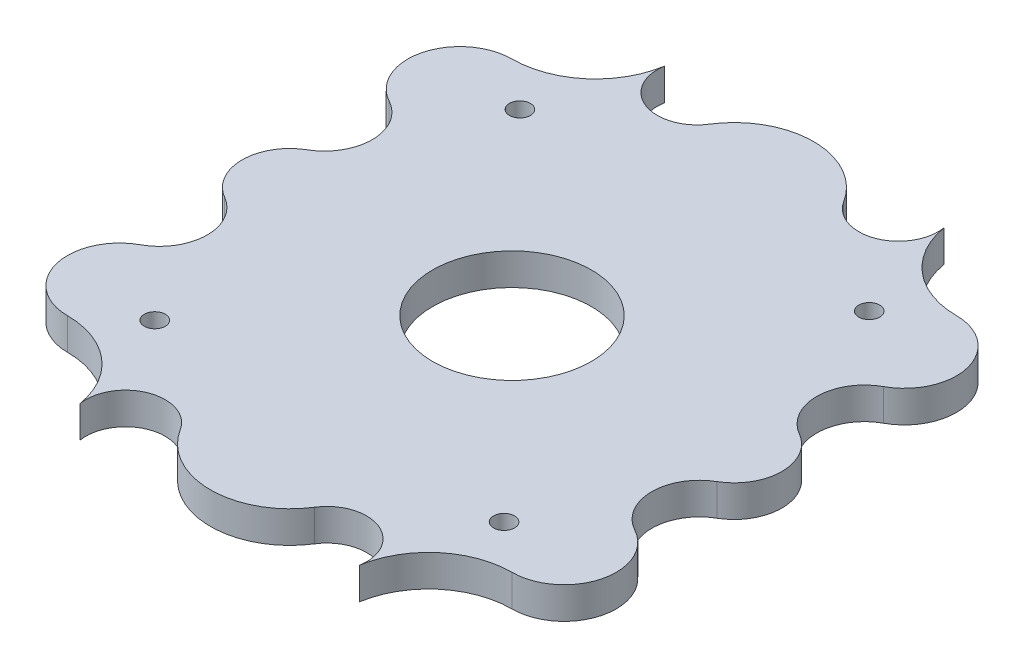
from build123d import *

# Parameters (mm, degrees)
SALIENTE_EXTRUIR1_DEPTH                              = 10
SALIENTE_EXTRUIR2_DEPTH                              = 10
CROQUIS3_R                                           = 25
CORTAR_EXTRUIR1_DEPTH                                = 10
REFRENTADO_PARA_TORNILLO_CON_CABEZA_HUEC_D           = 6.6
REFRENTADO_PARA_TORNILLO_CON_CABEZA_HUEC_CBORE_D     = 11
REFRENTADO_PARA_TORNILLO_CON_CABEZA_HUEC_CBORE_DEPTH = 4.4


with BuildPart() as part:
    # Croquis1 → Saliente-Extruir1 (new body)
    with BuildSketch(Plane(origin=(0, 0, 0), x_dir=(1, 0, 0), z_dir=(0, 1, 0))):
        with BuildLine():
            Line((-70, -70), (-70, 70))
            ThreePointArc((-70, 70), (-52.983030462, 76.249658661), (-44.055908755, 92.027554074))
            ThreePointArc((-44.055908755, 92.027554074), (-36.156795126, 78.313355526), (-21.147629234, 83.333333333))
            ThreePointArc((-21.147629234, 83.333333333), (0, 95), (21.147629234, 83.333333333))
            ThreePointArc((21.147629234, 83.333333333), (36.156795126, 78.313355526), (44.055908755, 92.027554074))
            ThreePointArc((44.055908755, 92.027554074), (52.983030462, 76.249658661), (70, 70))
            Line((70, 70), (70, -70))
            ThreePointArc((70, -70), (52.983030462, -76.249658661), (44.055908755, -92.027554074))
            ThreePointArc((44.055908755, -92.027554074), (36.156795126, -78.313355526), (21.147629234, -83.333333333))
            ThreePointArc((21.147629234, -83.333333333), (0, -95), (-21.147629234, -83.333333333))
            ThreePointArc((-21.147629234, -83.333333333), (-36.156795126, -78.313355526), (-44.055908755, -92.027554074))
            ThreePointArc((-44.055908755, -92.027554074), (-52.983030462, -76.249658661), (-70, -70))
        make_face()
    extrude(amount=SALIENTE_EXTRUIR1_DEPTH)

    # Croquis2 → Saliente-Extruir2 (add)
    with BuildSketch(Plane(origin=(0, 10, 0), x_dir=(1, 0, 0), z_dir=(0, 1, 0))):
        with BuildLine():
            ThreePointArc((77.837993487, 39.160506523), (85.909969357, 57.627811916), (70, 70))
            Line((70, 70), (70, 25.98076213))
            ThreePointArc((70, 25.98076213), (72.107558465, 33.647896602), (77.837993487, 39.160506523))
        make_face()
        with BuildLine():
            ThreePointArc((77.837993487, -39.160506523), (72.107558465, -33.647896602), (70, -25.98076213))
            Line((70, -25.98076213), (70, -70))
            ThreePointArc((70, -70), (85.909969357, -57.627811916), (77.837993487, -39.160506523))
        make_face()
        with BuildLine():
            ThreePointArc((77.5, 12.990381057), (72.009618939, 18.480762121), (70, 25.98076213))
            Line((70, 25.98076213), (70, -25.98076213))
            ThreePointArc((70, -25.98076213), (72.009618939, -18.480762121), (77.5, -12.990381057))
            ThreePointArc((77.5, -12.990381057), (85, 0), (77.5, 12.990381057))
        make_face()
        with BuildLine():
            Line((-70, -70), (-70, -25.980762199))
            ThreePointArc((-70, -25.980762199), (-72.107558482, -33.647896631), (-77.837993487, -39.160506523))
            ThreePointArc((-77.837993487, -39.160506523), (-85.909969357, -57.627811916), (-70, -70))
        make_face()
        with BuildLine():
            Line((-70, -25.980762199), (-70, 25.98076189))
            ThreePointArc((-70, 25.98076189), (-72.009618999, 18.480762017), (-77.5, 12.990381057))
            ThreePointArc((-77.5, 12.990381057), (-85, 0), (-77.5, -12.990381057))
            ThreePointArc((-77.5, -12.990381057), (-72.009618922, -18.480762151), (-70, -25.980762199))
        make_face()
        with BuildLine():
            Line((-70, 25.98076189), (-70, 70))
            ThreePointArc((-70, 70), (-85.909969357, 57.627811916), (-77.837993487, 39.160506523))
            ThreePointArc((-77.837993487, 39.160506523), (-72.107558403, 33.647896498), (-70, 25.98076189))
        make_face()
    extrude(amount=-SALIENTE_EXTRUIR2_DEPTH)

    # Croquis3 → Cortar-Extruir1 (cut)
    with BuildSketch(Plane(origin=(0, 10, 0), x_dir=(1, 0, 0), z_dir=(0, 1, 0))):
        Circle(CROQUIS3_R)
    extrude(amount=-CORTAR_EXTRUIR1_DEPTH, mode=Mode.SUBTRACT)

    # Refrentado para tornillo con cabeza hueca de M61 (through all)
    with Locations(Plane(origin=(-55, 0, 57.5), x_dir=(0, 0, -1), z_dir=(0, -1, 0))):
        with Locations((0, 0), (0, 110), (115, 110), (115, 0), (57.5, 55)):
            CounterBoreHole(REFRENTADO_PARA_TORNILLO_CON_CABEZA_HUEC_D / 2, REFRENTADO_PARA_TORNILLO_CON_CABEZA_HUEC_CBORE_D / 2, REFRENTADO_PARA_TORNILLO_CON_CABEZA_HUEC_CBORE_DEPTH)


solid = part.part
